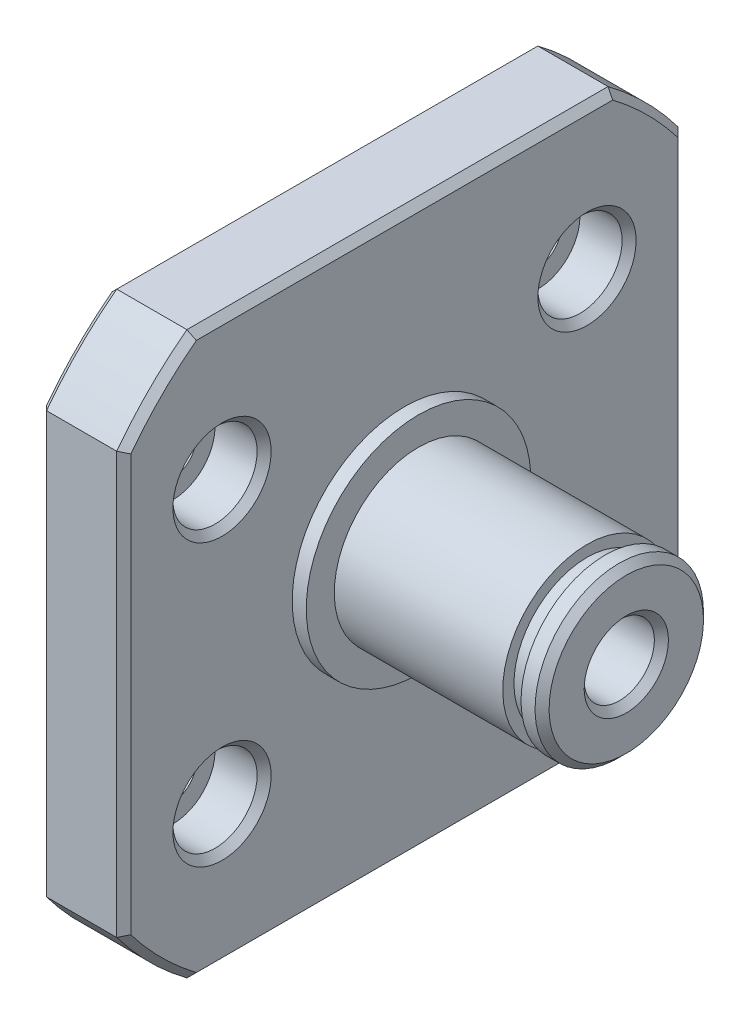
from build123d import *

# Parameters (mm, degrees)
SKETCH_5_R          = 1.65
CUT_EXTRUDE_6_DEPTH = 39.725185603
SKETCH_6_R          = 3
CUT_EXTRUDE_7_DEPTH = 3.5
CHAMFER_2_SIZE      = 0.5
CUT_EXTRUDE_8_DEPTH = 36.710502657


with BuildPart() as part:
    # 草图1 → 旋转1 (revolve)
    with BuildSketch(Plane.XY):
        Polygon((0, 1.5), (0, 25), (6, 25), (6, 8), (7, 8), (7, 6), (19, 6), (19, 5.2), (20.3, 5.2), (20.3, 6), (21.8, 6), (21.8, 2.5), (16.8, 2.5), (16.8, 1.5), align=None)
    revolve(axis=Axis((15.775828358, 0, 0), (-1, 0, 0)))

    # 草图5 → 切除-拉伸6 (cut, through all)
    with BuildSketch(Plane(origin=(6, 0, 0), x_dir=(0, 0, -1), z_dir=(1, 0, 0))):
        with Locations((-13, 10)):
            Circle(SKETCH_5_R)
        with Locations((-13, -10)):
            Circle(SKETCH_5_R)
        with Locations((13, -10)):
            Circle(SKETCH_5_R)
        with Locations((13, 10)):
            Circle(SKETCH_5_R)
        with BuildLine():
            Line((-15, 20), (15, 20))
            ThreePointArc((15, 20), (0, 25), (-15, 20))
        make_face()
        with BuildLine():
            Line((-20, 15), (-20, -15))
            ThreePointArc((-20, -15), (-25, 0), (-20, 15))
        make_face()
        with BuildLine():
            Line((-15, -20), (15, -20))
            ThreePointArc((15, -20), (0, -25), (-15, -20))
        make_face()
        with BuildLine():
            Line((20, 15), (20, -15))
            ThreePointArc((20, -15), (25, 0), (20, 15))
        make_face()
    extrude(amount=-CUT_EXTRUDE_6_DEPTH, mode=Mode.SUBTRACT)

    # 草图6 → 切除-拉伸7 (cut)
    with BuildSketch(Plane(origin=(6, 0, 0), x_dir=(0, 0, -1), z_dir=(1, 0, 0))):
        with Locations((-13, 10)):
            Circle(SKETCH_6_R)
        with Locations((13, 10)):
            Circle(SKETCH_6_R)
        with Locations((-13, -10)):
            Circle(SKETCH_6_R)
        with Locations((13, -10)):
            Circle(SKETCH_6_R)
    extrude(amount=-CUT_EXTRUDE_7_DEPTH, mode=Mode.SUBTRACT)

    # 倒角2
    chamfer_2_edges = [part.edges().sort_by_distance(p)[0] for p in [
        (0, -1.5, 0),
        (21.8, -6, 0),
        (21.8, -2.5, 0),
        (6, 17.67766953, 17.67766953),
        (6, 20, 0),
        (6, 17.67766953, -17.67766953),
        (6, 0, -20),
        (6, -17.67766953, -17.67766953),
        (6, -20, 0),
        (6, -17.67766953, 17.67766953),
        (6, 0, 20),
        (0, -10, -11.35),
        (0, -10, 14.65),
        (0, 10, 14.65),
        (0, 10, -11.35),
        (0, 17.67766953, -17.67766953),
        (0, 20, 0),
        (0, 17.67766953, 17.67766953),
        (0, 0, 20),
        (0, -17.67766953, 17.67766953),
        (0, -20, 0),
        (0, -17.67766953, -17.67766953),
        (0, 0, -20),
        (6, -10, -10),
        (6, -10, 16),
        (6, 10, -10),
        (6, 10, 16),
    ]]
    chamfer(chamfer_2_edges, length=CHAMFER_2_SIZE)

    # 草图7 → 切除-拉伸8 (cut, through all)
    with BuildSketch(Plane(origin=(21.8, 0, 0), x_dir=(0, 0, -1), z_dir=(1, 0, 0))):
        with BuildLine():
            Line((-2, 1.5), (2, 1.5))
            ThreePointArc((2, 1.5), (2.5, 0), (2, -1.5))
            Line((2, -1.5), (-2, -1.5))
            ThreePointArc((-2, -1.5), (-2.5, 0), (-2, 1.5))
        make_face()
    extrude(amount=-CUT_EXTRUDE_8_DEPTH, mode=Mode.SUBTRACT)


solid = part.part
